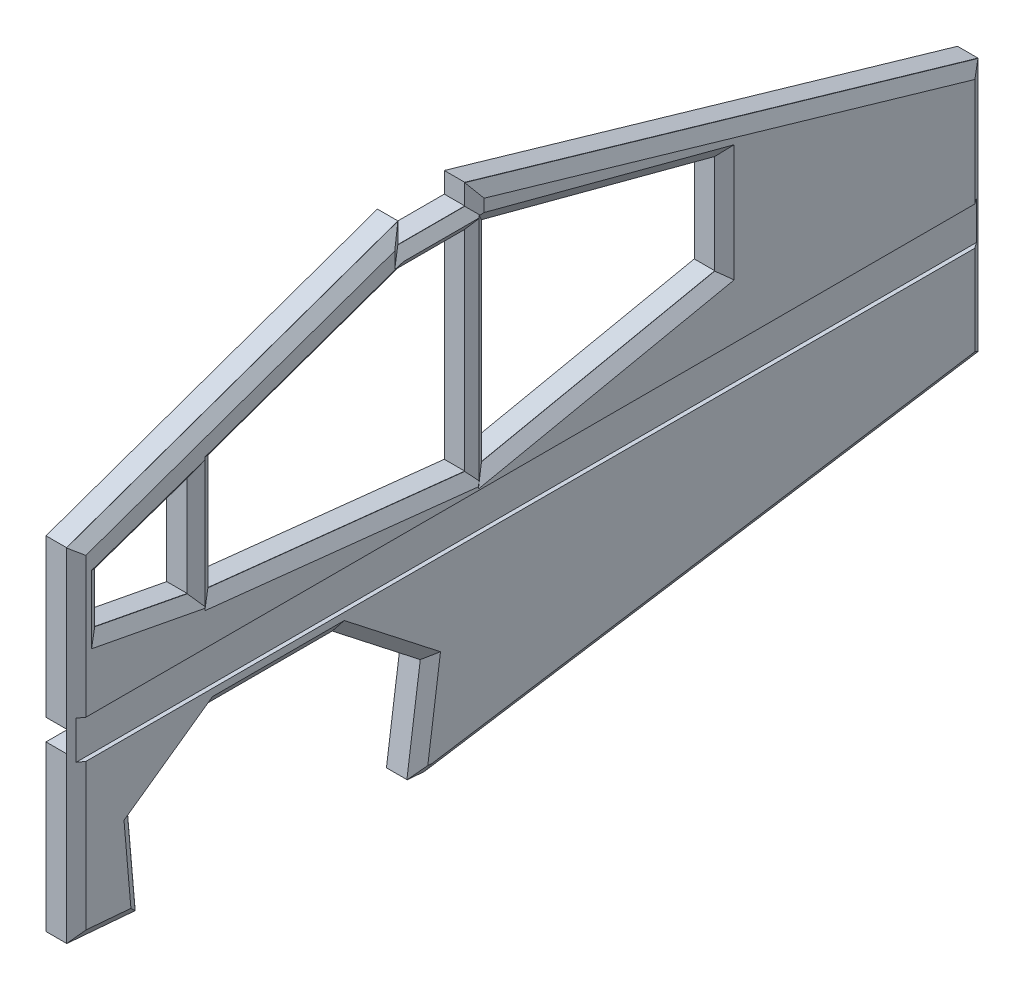
from build123d import *

# Parameters (mm, degrees)
BOSS_EXTRUDE1_DEPTH = 6.35
SKETCH2_W           = 82.651107169
SKETCH2_H           = 6.52720724
SKETCH2_W_2         = 76.969823319
SKETCH2_H_2         = 6.604
CUT_EXTRUDE1_DEPTH  = 198.994632127
BOSS_EXTRUDE2_DEPTH = 2.54
BOSS_EXTRUDE2_TAPER = 54
CUT_EXTRUDE2_START  = 1.27
SKETCH4_W           = 282.286375736
SKETCH4_H           = 11.861401259
CUT_EXTRUDE2_DEPTH  = 2.54


with BuildPart() as part:
    # Sketch1 → Boss-Extrude1 (new body)
    with BuildSketch(Plane(origin=(0, 0, 0), x_dir=(0, 0, -1), z_dir=(1, 0, 0))):
        Polygon((159.176354991, -7.404948939), (159.176354991, 71.350976637), (0, 117.577378193), (0, 111.227378193), (-20.735936364, 111.227378193), (-20.735936364, 117.577378193), (-123.525645009, 81.218983384), (-123.525645009, -25.082949612), (-102.22101814, -26.860004783), (-104.557017494, 0), (-79.646789796, 17.686261666), (-41.094549164, 17.686261666), (-13.779824281, -3.641289166), (-17.947471695, -33.889404663), (-12.561862574, -34.338627482), align=None)
        Polygon((5.201841666, 40.001048477), (77.528248196, 55.056292197), (77.528248196, 85.830387495), (5.201841666, 105.015188817), align=None, mode=Mode.SUBTRACT)
        Polygon((-79.646789796, 84.224142025), (-79.646789796, 48.574048336), (0, 40.007327233), (0, 105.015188817), (-20.735936364, 105.015188817), align=None, mode=Mode.SUBTRACT)
        Polygon((-86.090479579, 81.218983384), (-86.090479579, 50.197772081), (-114.759972161, 55.666680192), (-114.759972161, 71.350976637), align=None, mode=Mode.SUBTRACT)
    extrude(amount=BOSS_EXTRUDE1_DEPTH)

    # Sketch2 → Cut-Extrude1 (cut, through all)
    with BuildSketch(Plane(origin=(6.35, 0, 0), x_dir=(0, 0, -1), z_dir=(1, 0, 0))):
        with Locations((117.850801407, 29.125465717)):
            Rectangle(SKETCH2_W, SKETCH2_H)
        with Locations((-85.04073335, 29.163862097)):
            Rectangle(SKETCH2_W_2, SKETCH2_H_2)
    extrude(amount=-CUT_EXTRUDE1_DEPTH, mode=Mode.SUBTRACT)

    # Sketch5 → Boss-Extrude2 (add)
    with BuildSketch(Plane(origin=(6.35, 0, 0), x_dir=(0, 0, -1), z_dir=(1, 0, 0))):
        Polygon((159.159364296, -7.492632193), (159.159364296, 71.263293383), (-0.016990695, 117.489694939), (-0.016990695, 111.139694939), (-20.752927059, 111.139694939), (-20.752927059, 117.489694939), (-123.542635704, 81.13130013), (-123.542635704, -25.170632866), (-102.238008835, -26.947688037), (-104.57400819, -0.087683254), (-79.663780492, 17.598578412), (-41.11153986, 17.598578412), (-13.796814976, -3.72897242), (-17.96446239, -33.977087917), (-12.578853269, -34.426310736), align=None)
        Polygon((5.184850971, 39.913365223), (77.5112575, 54.968608943), (77.5112575, 85.742704241), (5.184850971, 104.927505563), align=None, mode=Mode.SUBTRACT)
        Polygon((-79.663780492, 84.136458771), (-79.663780492, 48.486365082), (-0.016990695, 39.919643979), (-0.016990695, 104.927505563), (-20.752927059, 104.927505563), align=None, mode=Mode.SUBTRACT)
        Polygon((-86.107470274, 81.13130013), (-86.107470274, 50.110088827), (-114.776962856, 55.578996938), (-114.776962856, 71.263293383), align=None, mode=Mode.SUBTRACT)
    extrude(amount=BOSS_EXTRUDE2_DEPTH, taper=BOSS_EXTRUDE2_TAPER)

    # Sketch4 → Cut-Extrude2 (cut)
    with BuildSketch(Plane(origin=(6.35, 0, 0), x_dir=(0, 0, -1), z_dir=(1, 0, 0)).offset(CUT_EXTRUDE2_START)):
        with Locations((17.617542859, 29.257395972)):
            Rectangle(SKETCH4_W, SKETCH4_H)
    extrude(amount=CUT_EXTRUDE2_DEPTH, mode=Mode.SUBTRACT)


solid = part.part
